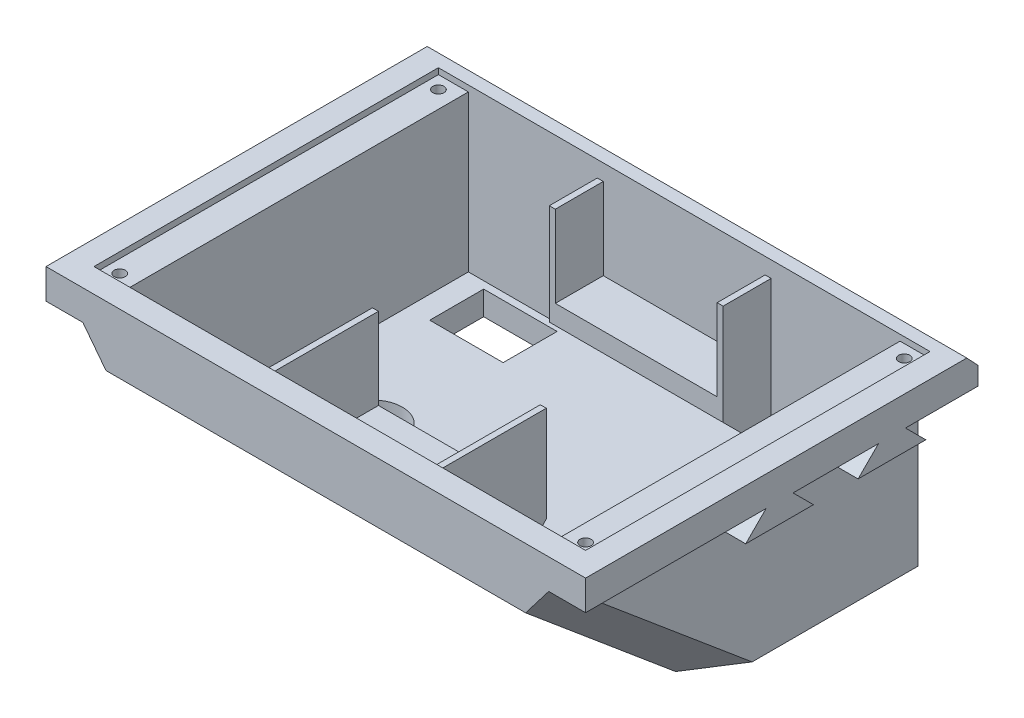
from build123d import *

# Parameters (mm, degrees)
SKETCH1_W           = 80
SKETCH1_H           = 65.45
BOSS_EXTRUDE1_DEPTH = 31
BOSS_EXTRUDE3_DEPTH = 5
CHAMFER2_SIZE       = 25
CHAMFER2_SIZE2      = 20.977490779
SHELL2_START        = -36
SHELL2_DEPTH        = 72
SHELL2_START_2      = -41
SHELL2_2_OUTLINE_W  = 1
SHELL2_2_OUTLINE_H  = 57.45
SHELL2_2_DEPTH      = 82
SKETCH6_R           = 4.86874318
CUT_EXTRUDE1_DEPTH  = 5
BOSS_EXTRUDE4_DEPTH = 8
BOSS_EXTRUDE5_REACH = 107.939
BOSS_EXTRUDE5_START = 29.5
SKETCH10_W          = 12.25
SKETCH10_H          = 9
CUT_EXTRUDE2_DEPTH  = 6
CHAMFER3_SIZE       = 2
CHAMFER3_SIZE2      = 1.865030172
CHAMFER4_SIZE       = 7.098078142
CHAMFER4_SIZE_2     = 10
CHAMFER5_SIZE       = 10
CHAMFER7_SIZE       = 5
SKETCH11_R          = 0.93
CUT_EXTRUDE3_DEPTH  = 7


# Read off the part's stored shape, not the designer's step: Shell2
with BuildPart() as part:
    # Sketch1 → Boss-Extrude1 (new body)
    with BuildSketch(Plane(origin=(0, 0, 0), x_dir=(1, 0, 0), z_dir=(0, 1, 0))):
        Rectangle(SKETCH1_W, SKETCH1_H)
    extrude(amount=BOSS_EXTRUDE1_DEPTH)

    # Sketch5 → Boss-Extrude3 (add)
    with BuildSketch(Plane.ZY.offset(40)):
        Polygon((-32.725, 31), (-20.625, 31), (8.005, 31), (32.725, 31), (32.725, 26), (2.6203214, 26), (6.0203214, 22.6), (-5.2796786, 22.6), (-1.8796786, 26), (-16.125, 26), (-12.725, 22.6), (-24.025, 22.6), (-20.625, 26), (-32.725, 26), align=None)
    boss_extrude3 = extrude(amount=BOSS_EXTRUDE3_DEPTH)

    # Mirror1: Boss-Extrude3 across plane
    add(boss_extrude3.mirror(Plane(origin=(0, 0, 0), x_dir=(0, 0, 1), z_dir=(1, 0, 0))))

    # Chamfer2
    chamfer2_edges = [part.edges().sort_by_distance(p)[0] for p in [
        (0, 0, 32.725),
    ]]
    chamfer2_side = [part.faces().sort_by_distance(p)[0] for p in [
        (0, 0, 0),
    ]]
    chamfer(chamfer2_edges, length=CHAMFER2_SIZE, length2=CHAMFER2_SIZE2, reference=chamfer2_side[0])

    # Shell2 outline → Shell2 (cut)
    with BuildSketch(Plane.YZ.offset(SHELL2_START)):
        Polygon((22.842721412, 28.725), (4, 6.269119063), (4, -28.725), (31, -28.725), (31, 28.725), align=None)
    extrude(amount=SHELL2_DEPTH, mode=Mode.SUBTRACT)

    # Shell2 2 outline → Shell2 2 (cut)
    with BuildSketch(Plane.YZ.offset(SHELL2_START_2)):
        with Locations((30.5, 0)):
            Rectangle(SHELL2_2_OUTLINE_W, SHELL2_2_OUTLINE_H)
    extrude(amount=SHELL2_2_DEPTH, mode=Mode.SUBTRACT)

    # Sketch6 → Cut-Extrude1 (cut)
    with BuildSketch(Plane(origin=(0, 4, 24.632603001), x_dir=(1, 0, 0), z_dir=(0, 1, 0))):
        with Locations(Location((22, 23.453346141, 0), (0, 0, 270))):
            Circle(SKETCH6_R)
        with Locations(Location((-22, 23.453346141, 0), (0, 0, 270))):
            Circle(SKETCH6_R)
    extrude(amount=-CUT_EXTRUDE1_DEPTH, mode=Mode.SUBTRACT)

    # Sketch7 → Boss-Extrude4 (add)
    with BuildSketch(Plane.XY.offset(-28.725)):
        Polygon((-14.5, 13.5), (14.5, 13.5), (14.5, 28.31455183), (13.5, 28.31455183), (13.5, 14.706896552), (-13.5, 14.706896552), (-13.5, 28.31455183), (-14.5, 28.31455183), align=None)
    extrude(amount=BOSS_EXTRUDE4_DEPTH)

    # Sketch8 → Boss-Extrude5 (add, up to next)
    with BuildSketch(Plane.XY.offset(-20.725).offset(BOSS_EXTRUDE5_START), mode=Mode.PRIVATE) as boss_extrude5_sk1:
        Polygon((-13.5, 14.706896552), (-13.5, 28.31455183), (-14.5, 28.31455183), (-14.5, 14.706896552), (-14.5, 13.5), (-13.5, 13.5), (13.5, 13.5), (14.5, 13.5), (14.5, 14.706896552), (14.5, 28.31455183), (13.5, 28.31455183), (13.5, 14.706896552), align=None)
    boss_extrude5_tool1 = extrude(boss_extrude5_sk1.sketch, amount=BOSS_EXTRUDE5_REACH, mode=Mode.PRIVATE) - part.part
    add(boss_extrude5_tool1.solids().sort_by_distance((-14.174351, 21.510724, 8.775))[0])

    # Sketch10 → Cut-Extrude2 (cut)
    with BuildSketch(Plane.XZ):
        with Locations((-26.125, -23.025)):
            Rectangle(SKETCH10_W, SKETCH10_H)
        with Locations((26.125, -23.025)):
            Rectangle(SKETCH10_W, SKETCH10_H)
    extrude(amount=-CUT_EXTRUDE2_DEPTH, mode=Mode.SUBTRACT)

    # Chamfer3
    chamfer3_edges = [part.edges().sort_by_distance(p)[0] for p in [
        (0, 31, -32.725),
    ]]
    chamfer3_side = [part.faces().sort_by_distance(p)[0] for p in [
        (0, 15.756916996, -32.725),
    ]]
    chamfer(chamfer3_edges, length=CHAMFER3_SIZE, length2=CHAMFER3_SIZE2, reference=chamfer3_side[0])

    # Chamfer4
    # the kernel refuses this chamfer: 10, 7.098078142 mm, written as the material it adds along each edge
    with BuildSketch(Plane(origin=(14.5, 13.5, 17.590778193), x_dir=(0, -0.6849156240265527, -0.728622390518105), z_dir=(-1, 0, 0))) as chamfer4_piece_1_section:
        Polygon((CHAMFER4_SIZE * 0.998412410217, -CHAMFER4_SIZE * 0.0563263630269), (CHAMFER4_SIZE_2 * 0.728622390518, -CHAMFER4_SIZE_2 * 0.684915624027), (0, 0), align=None)
    chamfer4_piece_1 = extrude(amount=29, mode=Mode.PRIVATE)
    chamfer4_piece_1 = split(chamfer4_piece_1, bisect_by=Plane(origin=(0, 11.943437141, 8.775), z_dir=(0, 0, 1)), keep=Keep.TOP, mode=Mode.PRIVATE)
    add(chamfer4_piece_1)

    # Chamfer5
    # the kernel refuses this chamfer: 10 mm, written as the material it adds along each edge
    with BuildSketch(Plane(origin=(-14.5, 13.5, -28.725), x_dir=(0, -0.9996219169112968, -0.02749587661058701), z_dir=(1, 0, 0))) as chamfer5_piece_1_section:
        Polygon((CHAMFER5_SIZE * 0.999621916911, -CHAMFER5_SIZE * 0.0274958766106), (-CHAMFER5_SIZE * 0.0274958766106, -CHAMFER5_SIZE * 0.999621916911), (0, 0), align=None)
    chamfer5_piece_1 = extrude(amount=29, mode=Mode.PRIVATE)
    chamfer5_piece_1 = split(chamfer5_piece_1, bisect_by=Plane(origin=(0, 10.042815877, -20.725), z_dir=(0, 0, -1)), keep=Keep.TOP, mode=Mode.PRIVATE)
    add(chamfer5_piece_1)

    # Chamfer7
    chamfer7_edges = [part.edges().sort_by_distance(p)[0] for p in [
        (40, 10.48874539, 20.225),
        (-40, 10.48874539, 20.225),
        (-40, 13, -32.725),
        (40, 13, -32.725),
    ]]
    chamfer(chamfer7_edges, length=CHAMFER7_SIZE)

    # Sketch11 → Cut-Extrude3 (cut)
    with BuildSketch(Plane(origin=(0, 30, 0), x_dir=(1, 0, 0), z_dir=(0, 1, 0))):
        with Locations(Location((38.849613738, -26.574613738, 0), (0, 0, 270))):
            Circle(SKETCH11_R)
        with Locations(Location((38.849613738, 26.574613738, 0), (0, 0, 90))):
            Circle(SKETCH11_R)
        with Locations(Location((-38.849613738, 26.574613738, 0), (0, 0, 270))):
            Circle(SKETCH11_R)
        with Locations(Location((-38.849613738, -26.574613738, 0), (0, 0, 90))):
            Circle(SKETCH11_R)
    extrude(amount=-CUT_EXTRUDE3_DEPTH, mode=Mode.SUBTRACT)


solid = part.part
